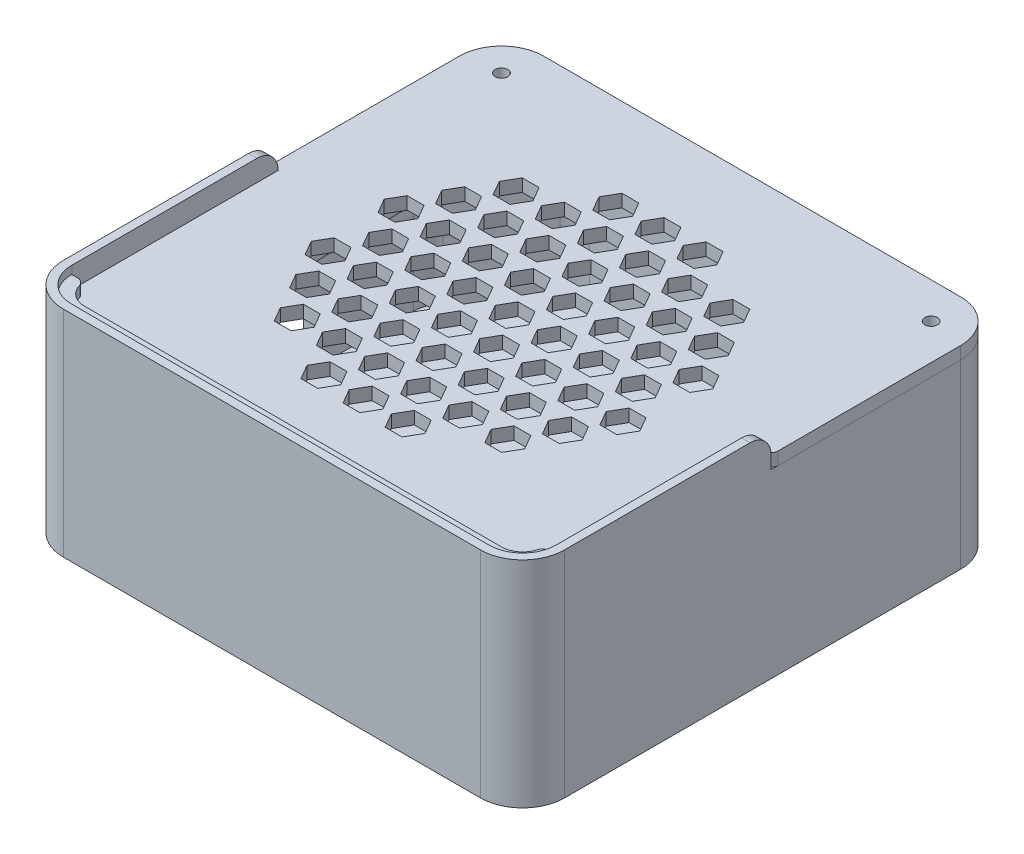
from build123d import *

# Parameters (mm, degrees)
CROQUIS1_W                 = 115
CROQUIS1_H                 = 110
SALIENTE_EXTRUIR1_DEPTH    = 3
CROQUIS2_W                 = 115
CROQUIS2_H                 = 110
CROQUIS2_W_2               = 111
CROQUIS2_H_2               = 106
SALIENTE_EXTRUIR2_DEPTH    = 40
CROQUIS3_W                 = 115
CROQUIS3_H                 = 110
SALIENTE_EXTRUIR3_DEPTH    = 3
CROQUIS4_R                 = 42.5
CORTAR_EXTRUIR1_DEPTH      = 3
SALIENTE_EXTRUIR5_DEPTH    = 2.8
SALIENTE_EXTRUIR6_DEPTH    = 3
SALIENTE_EXTRUIR7_DEPTH    = 40
CORTAR_EXTRUIR3_DEPTH      = 5.8
CROQUIS11_R                = 1.5
CORTAR_EXTRUIR4_DEPTH      = 40
CROQUIS12_R                = 5
CORTAR_EXTRUIR5_DEPTH      = 3
REDONDEO1_R                = 1.5
REDONDEO2_R                = 8
REDONDEO3_R                = 8
CROQUIS14_R                = 42.5
SALIENTE_EXTRUIR9_DEPTH    = 3
PATR_N_START               = 43
PATR_N_DE_RAYADO1_DEPTH    = 3
SALIENTE_EXTRUIR10_DEPTH   = 51
CORTAR_EXTRUIR6_DEPTH      = 17
CORTAR_EXTRUIR6_DEPTH_BACK = 4
CROQUIS13_W                = 20
CROQUIS13_H                = 10
SALIENTE_EXTRUIR12_DEPTH   = 2.5
CORTAR_EXTRUIR7_DEPTH      = 8
SALIENTE_EXTRUIR13_DEPTH   = 3
REDONDEO4_R                = 5
CROQUIS21_W                = 2
CROQUIS21_H                = 3
CORTAR_EXTRUIR8_DEPTH      = 0.1
REDONDEO6_R                = 1.5
REDONDEO8_R                = 2
REDONDEO9_R                = 7
CORTAR_EXTRUIR9_START      = 5.8
CORTAR_EXTRUIR9_DEPTH      = 5.8
SALIENTE_EXTRUIR15_DEPTH   = 2.8
SALIENTE_EXTRUIR16_DEPTH   = 2.8


# Read off the part's stored shape, not the designer's step: Patrón de rayado1
with BuildPart() as part:
    # Croquis1 → Saliente-Extruir1 (new body)
    with BuildSketch(Plane(origin=(0, 0, 0), x_dir=(1, 0, 0), z_dir=(0, 1, 0))):
        Rectangle(CROQUIS1_W, CROQUIS1_H)
    extrude(amount=SALIENTE_EXTRUIR1_DEPTH)

    # Croquis2 → Saliente-Extruir2 (add)
    with BuildSketch(Plane(origin=(0, 3, 0), x_dir=(1, 0, 0), z_dir=(0, 1, 0))):
        Rectangle(CROQUIS2_W, CROQUIS2_H)
        Rectangle(CROQUIS2_W_2, CROQUIS2_H_2, mode=Mode.SUBTRACT)
    extrude(amount=SALIENTE_EXTRUIR2_DEPTH)

    # Croquis9 → Saliente-Extruir7 (add)
    with BuildSketch(Plane(origin=(0, 3, 0), x_dir=(1, 0, 0), z_dir=(0, 1, 0))):
        Polygon((-55.5, 53), (-37.5, 53), (-55.5, 35), align=None)
        Polygon((55.5, 53), (37.5, 53), (55.5, 35), align=None)
        Polygon((-55.5, -53), (-55.5, -35), (-37.5, -53), align=None)
        Polygon((37.5, -53), (55.5, -53), (55.5, -35), align=None)
    extrude(amount=SALIENTE_EXTRUIR7_DEPTH)


with BuildPart() as body_2:
    # Croquis3 → Saliente-Extruir3 (new body)
    with BuildSketch(Plane(origin=(0, 43, 0), x_dir=(1, 0, 0), z_dir=(0, 1, 0))):
        Rectangle(CROQUIS3_W, CROQUIS3_H)
    extrude(amount=SALIENTE_EXTRUIR3_DEPTH)

    # Croquis4 → Cortar-Extruir1 (cut)
    with BuildSketch(Plane.XZ.offset(-43)):
        with Locations(Location((0, 0, 0), (0, 0, 270))):
            Circle(CROQUIS4_R)
    extrude(amount=-CORTAR_EXTRUIR1_DEPTH, mode=Mode.SUBTRACT)

    # Croquis5 → Saliente-Extruir5 (add)
    with BuildSketch(Plane.XZ.offset(-43)):
        Polygon((-46, -46), (46, -46), (46, 26), (49, 26), (49, -49), (-49, -49), (-49, 26), (-46, 26), align=None)
    extrude(amount=SALIENTE_EXTRUIR5_DEPTH)

    # Croquis8 → Saliente-Extruir6 (add)
    with BuildSketch(Plane.XZ.offset(-40.2)):
        Polygon((-42.5, 26), (-42.5, -42.5), (42.5, -42.5), (42.5, 26), (49, 26), (49, -49), (-49, -49), (-49, 26), align=None)
    extrude(amount=SALIENTE_EXTRUIR6_DEPTH)

    # Croquis10 → Cortar-Extruir3 (cut)
    with BuildSketch(Plane.XZ.offset(-43)):
        Polygon((37.5, -53), (55.5, -53), (55.5, -35), align=None)
        Polygon((-55.5, -53), (-37.5, -53), (-55.5, -35), align=None)
        Polygon((55.5, 53), (37.5, 53), (55.5, 35), align=None)
        Polygon((-55.5, 35), (-37.5, 53), (-55.5, 53), align=None)
    extrude(amount=CORTAR_EXTRUIR3_DEPTH, mode=Mode.SUBTRACT)


with BuildPart() as cortar_extruir4_tool:
    # Croquis11 → Cortar-Extruir4 (new body)
    with BuildSketch(Plane(origin=(0, 46, 0), x_dir=(1, 0, 0), z_dir=(0, 1, 0))):
        with Locations(Location((-51, 48.5, 0), (0, 0, 270))):
            Circle(CROQUIS11_R)
        with Locations(Location((51, 48.5, 0), (0, 0, 270))):
            Circle(CROQUIS11_R)
    extrude(amount=-CORTAR_EXTRUIR4_DEPTH)


with BuildPart() as part_1:
    add(part.part)

    # Cortar-Extruir4: cut by cortar_extruir4_tool
    add(cortar_extruir4_tool.part, mode=Mode.SUBTRACT)

    # Croquis12 → Cortar-Extruir5 (cut)
    with BuildSketch(Plane(origin=(0, 3, 0), x_dir=(1, 0, 0), z_dir=(0, 1, 0))):
        with Locations((0, 20)):
            Circle(CROQUIS12_R)
        with BuildLine():
            Line((-2, 20), (-2, 30))
            ThreePointArc((-2, 30), (0, 32), (2, 30))
            Line((2, 30), (2, 20))
            ThreePointArc((2, 20), (0, 18), (-2, 20))
        make_face()
    extrude(amount=-CORTAR_EXTRUIR5_DEPTH, mode=Mode.SUBTRACT)

    # Redondeo1
    redondeo1_edges = [part_1.edges().sort_by_distance(p)[0] for p in [
        (2, 1.5, -24.582575695),
        (-2, 1.5, -24.582575695),
    ]]
    fillet(redondeo1_edges, radius=REDONDEO1_R)

    # Redondeo3
    redondeo3_edges = [part_1.edges().sort_by_distance(p)[0] for p in [
        (57.5, 21.5, 55),
        (-57.5, 21.5, 55),
        (-57.5, 21.5, -55),
        (57.5, 21.5, -55),
    ]]
    fillet(redondeo3_edges, radius=REDONDEO3_R)

    # Croquis15 → Saliente-Extruir10 (add)
    with BuildSketch(Plane.XZ):
        with BuildLine():
            Line((49.5, 57), (-49.5, 57))
            ThreePointArc((-49.5, 57), (-56.571067812, 54.071067812), (-59.5, 47))
            Line((-59.5, 47), (-59.5, -47))
            ThreePointArc((-59.5, -47), (-56.571067812, -54.071067812), (-49.5, -57))
            Line((-49.5, -57), (49.5, -57))
            ThreePointArc((49.5, -57), (56.571067812, -54.071067812), (59.5, -47))
            Line((59.5, -47), (59.5, 47))
            ThreePointArc((59.5, 47), (56.571067812, 54.071067812), (49.5, 57))
        make_face()
        with BuildLine():
            Line((57.5, -47), (57.5, 47))
            ThreePointArc((57.5, 47), (55.156854249, 52.656854249), (49.5, 55))
            Line((49.5, 55), (-49.5, 55))
            ThreePointArc((-49.5, 55), (-55.156854249, 52.656854249), (-57.5, 47))
            Line((-57.5, 47), (-57.5, -47))
            ThreePointArc((-57.5, -47), (-55.156854249, -52.656854249), (-49.5, -55))
            Line((-49.5, -55), (49.5, -55))
            ThreePointArc((49.5, -55), (55.156854249, -52.656854249), (57.5, -47))
        make_face(mode=Mode.SUBTRACT)
    extrude(amount=-SALIENTE_EXTRUIR10_DEPTH)

    # Croquis13 → Cortar-Extruir6 (cut, two sides: drawn at the far end of the back side and taken through both)
    with BuildSketch(Plane.ZY.offset(57.5).offset(-CORTAR_EXTRUIR6_DEPTH_BACK)):
        with Locations((0, 12)):
            Rectangle(CROQUIS13_W, CROQUIS13_H)
    extrude(amount=CORTAR_EXTRUIR6_DEPTH + CORTAR_EXTRUIR6_DEPTH_BACK, mode=Mode.SUBTRACT)

    # Croquis17 → Saliente-Extruir12 (add)
    with BuildSketch(Plane(origin=(0, 46.6, 0), x_dir=(1, 0, 0), z_dir=(0, 1, 0))):
        with BuildLine():
            Line((-49.5, -55), (49.5, -55))
            ThreePointArc((49.5, -55), (55.156854249, -52.656854249), (57.5, -47))
            Line((57.5, -47), (54.5, -47))
            ThreePointArc((54.5, -47), (53.035533906, -50.535533906), (49.5, -52))
            Line((49.5, -52), (-49.5, -52))
            ThreePointArc((-49.5, -52), (-53.035533906, -50.535533906), (-54.5, -47))
            Line((-54.5, -47), (-57.5, -47))
            ThreePointArc((-57.5, -47), (-55.156854249, -52.656854249), (-49.5, -55))
        make_face()
    extrude(amount=SALIENTE_EXTRUIR12_DEPTH)

    # Croquis18 → Cortar-Extruir7 (cut)
    with BuildSketch(Plane(origin=(0, 43, 0), x_dir=(1, 0, 0), z_dir=(0, 1, 0))):
        with BuildLine():
            Line((-49.5, 57), (49.5, 57))
            ThreePointArc((49.5, 57), (56.571067812, 54.071067812), (59.5, 47))
            Line((59.5, 47), (59.5, 2))
            Line((59.5, 2), (-59.5, 2))
            Line((-59.5, 2), (-59.5, 47))
            ThreePointArc((-59.5, 47), (-56.571067812, 54.071067812), (-49.5, 57))
        make_face()
    extrude(amount=CORTAR_EXTRUIR7_DEPTH, mode=Mode.SUBTRACT)

    # Redondeo4
    redondeo4_edges = [part_1.edges().sort_by_distance(p)[0] for p in [
        (-58.5, 51, -2),
        (58.5, 51, -2),
    ]]
    fillet(redondeo4_edges, radius=REDONDEO4_R)

    # Redondeo8
    redondeo8_edges = [part_1.edges().sort_by_distance(p)[0] for p in [
        (54.5, 47.85, 47),
        (-54.5, 47.85, 47),
    ]]
    fillet(redondeo8_edges, radius=REDONDEO8_R)

    # Redondeo9
    redondeo9_edges = [part_1.edges().sort_by_distance(p)[0] for p in [
        (-55.5, 23, -35),
        (-37.5, 23, -53),
        (55.5, 23, -35),
        (37.5, 23, -53),
        (-37.5, 23, 53),
        (-55.5, 23, 35),
        (55.5, 23, 35),
        (37.5, 23, 53),
    ]]
    fillet(redondeo9_edges, radius=REDONDEO9_R)


with BuildPart() as body_2_1:
    add(body_2.part)

    # Cortar-Extruir4: cut by cortar_extruir4_tool
    add(cortar_extruir4_tool.part, mode=Mode.SUBTRACT)

    # Redondeo2
    redondeo2_edges = [body_2_1.edges().sort_by_distance(p)[0] for p in [
        (-57.5, 44.5, -55),
        (57.5, 44.5, -55),
        (57.5, 44.5, 55),
        (-57.5, 44.5, 55),
    ]]
    fillet(redondeo2_edges, radius=REDONDEO2_R)

    # Croquis19 → Saliente-Extruir13 (add)
    with BuildSketch(Plane(origin=(0, 43, 0), x_dir=(1, 0, 0), z_dir=(0, 1, 0))):
        with BuildLine():
            Line((-59.5, 2), (-57.5, 2))
            Line((-57.5, 2), (-57.5, 47))
            ThreePointArc((-57.5, 47), (-55.156854249, 52.656854249), (-49.5, 55))
            Line((-49.5, 55), (49.5, 55))
            ThreePointArc((49.5, 55), (55.156854249, 52.656854249), (57.5, 47))
            Line((57.5, 47), (57.5, 2))
            Line((57.5, 2), (59.5, 2))
            Line((59.5, 2), (59.5, 47))
            ThreePointArc((59.5, 47), (56.571067812, 54.071067812), (49.5, 57))
            Line((49.5, 57), (-49.5, 57))
            ThreePointArc((-49.5, 57), (-56.571067812, 54.071067812), (-59.5, 47))
            Line((-59.5, 47), (-59.5, 2))
        make_face()
    extrude(amount=SALIENTE_EXTRUIR13_DEPTH)

    # Croquis21 → Cortar-Extruir8 (cut)
    with BuildSketch(Plane.XY.offset(-2)):
        with Locations((-58.5, 44.5)):
            Rectangle(CROQUIS21_W, CROQUIS21_H)
        with Locations((58.5, 44.5)):
            Rectangle(CROQUIS21_W, CROQUIS21_H)
    extrude(amount=-CORTAR_EXTRUIR8_DEPTH, mode=Mode.SUBTRACT)

    # Redondeo6
    redondeo6_edges = [body_2_1.edges().sort_by_distance(p)[0] for p in [
        (-59.5, 44.5, -2.1),
        (59.5, 44.5, -2.1),
    ]]
    fillet(redondeo6_edges, radius=REDONDEO6_R)

    # Croquis22 → Cortar-Extruir9 (cut)
    with BuildSketch(Plane.XZ.offset(-43).offset(CORTAR_EXTRUIR9_START)):
        with BuildLine():
            Line((59.5, -47), (59.5, -3.6))
            ThreePointArc((59.5, -3.6), (59.060660172, -2.539339828), (58, -2.1))
            Line((58, -2.1), (57.5, -2.1))
            Line((57.5, -2.1), (57.5, 47))
            ThreePointArc((57.5, 47), (55.156854249, 52.656854249), (49.5, 55))
            Line((49.5, 55), (-49.5, 55))
            ThreePointArc((-49.5, 55), (-55.156854249, 52.656854249), (-57.5, 47))
            Line((-57.5, 47), (-57.5, -2.1))
            Line((-57.5, -2.1), (-58, -2.1))
            ThreePointArc((-58, -2.1), (-59.060660172, -2.539339828), (-59.5, -3.6))
            Line((-59.5, -3.6), (-59.5, -47))
            ThreePointArc((-59.5, -47), (-56.571067812, -54.071067812), (-49.5, -57))
            Line((-49.5, -57), (49.5, -57))
            ThreePointArc((49.5, -57), (56.571067812, -54.071067812), (59.5, -47))
        make_face()
    extrude(amount=-CORTAR_EXTRUIR9_DEPTH, mode=Mode.SUBTRACT)


with BuildPart() as body_3:
    # Croquis14 → Saliente-Extruir9 (new body)
    with BuildSketch(Plane(origin=(0, 46, 0), x_dir=(1, 0, 0), z_dir=(0, 1, 0))):
        with Locations(Location((0, 0, 0), (0, 0, 90))):
            Circle(CROQUIS14_R)
    extrude(amount=-SALIENTE_EXTRUIR9_DEPTH)

    # Patrón de rayado1 outline → Patrón de rayado1 (cut)
    with BuildSketch(Plane(origin=(0, 0, 0), x_dir=(1, 0, 0), z_dir=(0, 1, 0)).offset(PATR_N_START)):
        Polygon((-31.000000307, 8.660257105), (-33.000000307, 12.12435872), (-37.000000307, 12.12435872), (-39.000000307, 8.660257105), (-37.000000307, 5.19615549), (-33.000000307, 5.19615549), align=None)
        Polygon((-16.000000307, -17.320505009), (-18.000000307, -13.856403393), (-22.000000307, -13.856403393), (-24.000000307, -17.320505009), (-22.000000307, -20.784606624), (-18.000000307, -20.784606624), align=None)
        Polygon((-21.000000307, -8.660250971), (-23.000000307, -5.196149356), (-27.000000307, -5.196149356), (-29.000000307, -8.660250971), (-27.000000307, -12.124352586), (-23.000000307, -12.124352586), align=None)
        Polygon((-26.000000307, 3.067e-06), (-28.000000307, 3.464104682), (-32.000000307, 3.464104682), (-34.000000307, 3.067e-06), (-32.000000307, -3.464098548), (-28.000000307, -3.464098548), align=None)
        Polygon((-11.000000307, -25.980759046), (-13.000000307, -22.516657431), (-17.000000307, -22.516657431), (-19.000000307, -25.980759046), (-17.000000307, -29.444860662), (-13.000000307, -29.444860662), align=None)
        Polygon((-6.000000307, -34.641013084), (-8.000000307, -31.176911469), (-12.000000307, -31.176911469), (-14.000000307, -34.641013084), (-12.000000307, -38.105114699), (-8.000000307, -38.105114699), align=None)
        Polygon((36.999999693, 12.12435872), (32.999999693, 12.12435872), (30.999999693, 8.660257105), (32.999999693, 5.19615549), (36.999999693, 5.19615549), (38.999999693, 8.660257105), align=None)
        Polygon((26.999999693, 12.12435872), (22.999999693, 12.12435872), (20.999999693, 8.660257105), (22.999999693, 5.19615549), (26.999999693, 5.19615549), (28.999999693, 8.660257105), align=None)
        Polygon((16.999999693, 12.12435872), (12.999999693, 12.12435872), (10.999999693, 8.660257105), (12.999999693, 5.19615549), (16.999999693, 5.19615549), (18.999999693, 8.660257105), align=None)
        Polygon((-3.000000307, 12.12435872), (-7.000000307, 12.12435872), (-9.000000307, 8.660257105), (-7.000000307, 5.19615549), (-3.000000307, 5.19615549), (-1.000000307, 8.660257105), align=None)
        Polygon((6.999999693, 12.12435872), (2.999999693, 12.12435872), (0.999999693, 8.660257105), (2.999999693, 5.19615549), (6.999999693, 5.19615549), (8.999999693, 8.660257105), align=None)
        Polygon((-13.000000307, 12.12435872), (-17.000000307, 12.12435872), (-19.000000307, 8.660257105), (-17.000000307, 5.19615549), (-13.000000307, 5.19615549), (-11.000000307, 8.660257105), align=None)
        Polygon((-23.000000307, 12.12435872), (-27.000000307, 12.12435872), (-29.000000307, 8.660257105), (-27.000000307, 5.19615549), (-23.000000307, 5.19615549), (-21.000000307, 8.660257105), align=None)
        Polygon((-32.000000307, 20.784612758), (-34.000000307, 17.320511143), (-32.000000307, 13.856409528), (-28.000000307, 13.856409528), (-26.000000307, 17.320511143), (-28.000000307, 20.784612758), align=None)
        Polygon((-27.000000307, 29.444866796), (-29.000000307, 25.980765181), (-27.000000307, 22.516663566), (-23.000000307, 22.516663566), (-21.000000307, 25.980765181), (-23.000000307, 29.444866796), align=None)
        Polygon((-6.000000307, 34.641019218), (-8.000000307, 38.105120834), (-12.000000307, 38.105120834), (-14.000000307, 34.641019218), (-12.000000307, 31.176917603), (-8.000000307, 31.176917603), align=None)
        Polygon((-1.000000307, 25.980765181), (-3.000000307, 29.444866796), (-7.000000307, 29.444866796), (-9.000000307, 25.980765181), (-7.000000307, 22.516663566), (-3.000000307, 22.516663566), align=None)
        Polygon((3.999999693, 17.320511143), (1.999999693, 20.784612758), (-2.000000307, 20.784612758), (-4.000000307, 17.320511143), (-2.000000307, 13.856409528), (1.999999693, 13.856409528), align=None)
        Polygon((13.999999693, 3.067e-06), (11.999999693, 3.464104682), (7.999999693, 3.464104682), (5.999999693, 3.067e-06), (7.999999693, -3.464098548), (11.999999693, -3.464098548), align=None)
        Polygon((28.999999693, -25.980759046), (26.999999693, -22.516657431), (22.999999693, -22.516657431), (20.999999693, -25.980759046), (22.999999693, -29.444860662), (26.999999693, -29.444860662), align=None)
        Polygon((23.999999693, -17.320505009), (21.999999693, -13.856403393), (17.999999693, -13.856403393), (15.999999693, -17.320505009), (17.999999693, -20.784606624), (21.999999693, -20.784606624), align=None)
        Polygon((18.999999693, -8.660250971), (16.999999693, -5.196149356), (12.999999693, -5.196149356), (10.999999693, -8.660250971), (12.999999693, -12.124352586), (16.999999693, -12.124352586), align=None)
        Polygon((1.999999693, 38.105120834), (-2.000000307, 38.105120834), (-4.000000307, 34.641019218), (-2.000000307, 31.176917603), (1.999999693, 31.176917603), (3.999999693, 34.641019218), align=None)
        Polygon((11.999999693, 38.105120834), (7.999999693, 38.105120834), (5.999999693, 34.641019218), (7.999999693, 31.176917603), (11.999999693, 31.176917603), (13.999999693, 34.641019218), align=None)
        Polygon((-17.000000307, 29.444866796), (-19.000000307, 25.980765181), (-17.000000307, 22.516663566), (-13.000000307, 22.516663566), (-11.000000307, 25.980765181), (-13.000000307, 29.444866796), align=None)
        Polygon((-37.000000307, -5.196149356), (-39.000000307, -8.660250971), (-37.000000307, -12.124352586), (-33.000000307, -12.124352586), (-31.000000307, -8.660250971), (-33.000000307, -5.196149356), align=None)
        Polygon((-22.000000307, 20.784612758), (-24.000000307, 17.320511143), (-22.000000307, 13.856409528), (-18.000000307, 13.856409528), (-16.000000307, 17.320511143), (-18.000000307, 20.784612758), align=None)
        Polygon((26.999999693, 29.444866796), (22.999999693, 29.444866796), (20.999999693, 25.980765181), (22.999999693, 22.516663566), (26.999999693, 22.516663566), (28.999999693, 25.980765181), align=None)
        Polygon((16.999999693, 29.444866796), (12.999999693, 29.444866796), (10.999999693, 25.980765181), (12.999999693, 22.516663566), (16.999999693, 22.516663566), (18.999999693, 25.980765181), align=None)
        Polygon((6.999999693, 29.444866796), (2.999999693, 29.444866796), (0.999999693, 25.980765181), (2.999999693, 22.516663566), (6.999999693, 22.516663566), (8.999999693, 25.980765181), align=None)
        Polygon((-12.000000307, 20.784612758), (-14.000000307, 17.320511143), (-12.000000307, 13.856409528), (-8.000000307, 13.856409528), (-6.000000307, 17.320511143), (-8.000000307, 20.784612758), align=None)
        Polygon((-32.000000307, -13.856403393), (-34.000000307, -17.320505009), (-32.000000307, -20.784606624), (-28.000000307, -20.784606624), (-26.000000307, -17.320505009), (-28.000000307, -13.856403393), align=None)
        Polygon((-22.000000307, 3.464104682), (-24.000000307, 3.067e-06), (-22.000000307, -3.464098548), (-18.000000307, -3.464098548), (-16.000000307, 3.067e-06), (-18.000000307, 3.464104682), align=None)
        Polygon((11.999999693, 20.784612758), (7.999999693, 20.784612758), (5.999999693, 17.320511143), (7.999999693, 13.856409528), (11.999999693, 13.856409528), (13.999999693, 17.320511143), align=None)
        Polygon((31.999999693, 20.784612758), (27.999999693, 20.784612758), (25.999999693, 17.320511143), (27.999999693, 13.856409528), (31.999999693, 13.856409528), (33.999999693, 17.320511143), align=None)
        Polygon((21.999999693, 20.784612758), (17.999999693, 20.784612758), (15.999999693, 17.320511143), (17.999999693, 13.856409528), (21.999999693, 13.856409528), (23.999999693, 17.320511143), align=None)
        Polygon((-27.000000307, -22.516657431), (-29.000000307, -25.980759046), (-27.000000307, -29.444860662), (-23.000000307, -29.444860662), (-21.000000307, -25.980759046), (-23.000000307, -22.516657431), align=None)
        Polygon((-12.000000307, 3.464104682), (-14.000000307, 3.067e-06), (-12.000000307, -3.464098548), (-8.000000307, -3.464098548), (-6.000000307, 3.067e-06), (-8.000000307, 3.464104682), align=None)
        Polygon((-17.000000307, -5.196149356), (-19.000000307, -8.660250971), (-17.000000307, -12.124352586), (-13.000000307, -12.124352586), (-11.000000307, -8.660250971), (-13.000000307, -5.196149356), align=None)
        Polygon((28.999999693, -8.660250971), (26.999999693, -5.196149356), (22.999999693, -5.196149356), (20.999999693, -8.660250971), (22.999999693, -12.124352586), (26.999999693, -12.124352586), align=None)
        Polygon((23.999999693, 3.067e-06), (21.999999693, 3.464104682), (17.999999693, 3.464104682), (15.999999693, 3.067e-06), (17.999999693, -3.464098548), (21.999999693, -3.464098548), align=None)
        Polygon((33.999999693, -17.320505009), (31.999999693, -13.856403393), (27.999999693, -13.856403393), (25.999999693, -17.320505009), (27.999999693, -20.784606624), (31.999999693, -20.784606624), align=None)
        Polygon((-12.000000307, -13.856403393), (-14.000000307, -17.320505009), (-12.000000307, -20.784606624), (-8.000000307, -20.784606624), (-6.000000307, -17.320505009), (-8.000000307, -13.856403393), align=None)
        Polygon((-2.000000307, 3.464104682), (-4.000000307, 3.067e-06), (-2.000000307, -3.464098548), (1.999999693, -3.464098548), (3.999999693, 3.067e-06), (1.999999693, 3.464104682), align=None)
        Polygon((-7.000000307, -5.196149356), (-9.000000307, -8.660250971), (-7.000000307, -12.124352586), (-3.000000307, -12.124352586), (-1.000000307, -8.660250971), (-3.000000307, -5.196149356), align=None)
        Polygon((27.999999693, 3.464104682), (25.999999693, 3.067e-06), (27.999999693, -3.464098548), (31.999999693, -3.464098548), (33.999999693, 3.067e-06), (31.999999693, 3.464104682), align=None)
        Polygon((12.999999693, -22.516657431), (10.999999693, -25.980759046), (12.999999693, -29.444860662), (16.999999693, -29.444860662), (18.999999693, -25.980759046), (16.999999693, -22.516657431), align=None)
        Polygon((7.999999693, -31.176911469), (5.999999693, -34.641013084), (7.999999693, -38.105114699), (11.999999693, -38.105114699), (13.999999693, -34.641013084), (11.999999693, -31.176911469), align=None)
        Polygon((38.999999693, -8.660250971), (36.999999693, -5.196149356), (32.999999693, -5.196149356), (30.999999693, -8.660250971), (32.999999693, -12.124352586), (36.999999693, -12.124352586), align=None)
        Polygon((2.999999693, -22.516657431), (0.999999693, -25.980759046), (2.999999693, -29.444860662), (6.999999693, -29.444860662), (8.999999693, -25.980759046), (6.999999693, -22.516657431), align=None)
        Polygon((-2.000000307, -31.176911469), (-4.000000307, -34.641013084), (-2.000000307, -38.105114699), (1.999999693, -38.105114699), (3.999999693, -34.641013084), (1.999999693, -31.176911469), align=None)
        Polygon((7.999999693, -13.856403393), (5.999999693, -17.320505009), (7.999999693, -20.784606624), (11.999999693, -20.784606624), (13.999999693, -17.320505009), (11.999999693, -13.856403393), align=None)
        Polygon((-7.000000307, -22.516657431), (-9.000000307, -25.980759046), (-7.000000307, -29.444860662), (-3.000000307, -29.444860662), (-1.000000307, -25.980759046), (-3.000000307, -22.516657431), align=None)
        Polygon((2.999999693, -5.196149356), (0.999999693, -8.660250971), (2.999999693, -12.124352586), (6.999999693, -12.124352586), (8.999999693, -8.660250971), (6.999999693, -5.196149356), align=None)
        Polygon((-2.000000307, -13.856403393), (-4.000000307, -17.320505009), (-2.000000307, -20.784606624), (1.999999693, -20.784606624), (3.999999693, -17.320505009), (1.999999693, -13.856403393), align=None)
    extrude(amount=PATR_N_DE_RAYADO1_DEPTH, mode=Mode.SUBTRACT)


    add(body_2_1.part)  # Saliente-Extruir15 merges body 2
    # Croquis23 → Saliente-Extruir15 (add)
    with BuildSketch(Plane.XZ.offset(-43)):
        with BuildLine():
            ThreePointArc((49, 0), (0, 49), (-49, 0))
            Line((-49, 0), (-46, 0))
            ThreePointArc((-46, 0), (0, 46), (46, 0))
            Line((46, 0), (49, 0))
        make_face()
        with BuildLine():
            ThreePointArc((46, -16.881943016), (48.244170632, -8.5732141), (49, 0))
            Line((49, 0), (46, 0))
            Line((46, 0), (46, -16.881943016))
        make_face()
        with BuildLine():
            Line((49, -25), (49, 0))
            ThreePointArc((49, 0), (48.244170632, -8.5732141), (46, -16.881943016))
            Line((46, -16.881943016), (46, -25))
            Line((46, -25), (49, -25))
        make_face()
        with BuildLine():
            Line((-46, 0), (-49, 0))
            ThreePointArc((-49, 0), (-48.244170632, -8.5732141), (-46, -16.881943016))
            Line((-46, -16.881943016), (-46, 0))
        make_face()
        with BuildLine():
            ThreePointArc((-46, -16.881943016), (-48.244170632, -8.5732141), (-49, 0))
            Line((-49, 0), (-49, -25))
            Line((-49, -25), (-46, -25))
            Line((-46, -25), (-46, -16.881943016))
        make_face()
    extrude(amount=SALIENTE_EXTRUIR15_DEPTH)

    # Croquis24 → Saliente-Extruir16 (add)
    with BuildSketch(Plane.XZ.offset(-40.2)):
        with BuildLine():
            Line((49, 0), (49, -25))
            Line((49, -25), (43, -25))
            Line((43, -25), (43, 0))
            ThreePointArc((43, 0), (0, 43), (-43, 0))
            Line((-43, 0), (-43, -25))
            Line((-43, -25), (-49, -25))
            Line((-49, -25), (-49, 0))
            ThreePointArc((-49, 0), (0, 49), (49, 0))
        make_face()
    extrude(amount=SALIENTE_EXTRUIR16_DEPTH)


solid = Compound([part_1.part, body_3.part])
